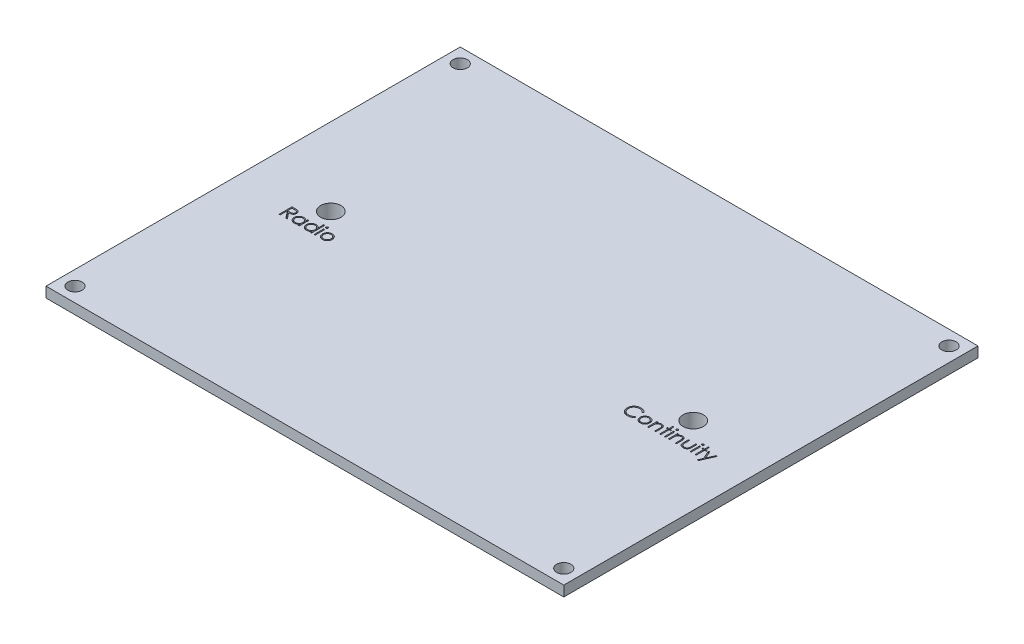
from build123d import *

# Parameters (mm, degrees)
IZIM1_W                     = 127
IZIM1_H                     = 101.6
Y_KSEKLIK_EKSTR_ZYON1_DEPTH = 2.54
IZIM3_W                     = 113.03
IZIM3_H                     = 87.63
Y_KSEKLIK_EKSTR_ZYON2_DEPTH = 1.27
IZIM4_R                     = 1.7526
KES_EKSTR_ZYON1_DEPTH       = 2.54
IZIM5_R                     = 1.7526
KES_EKSTR_ZYON2_DEPTH       = 2.54
IZIM7_R                     = 1.7526
KES_EKSTR_ZYON3_DEPTH       = 2.54
IZIM9_R                     = 1.7526
KES_EKSTR_ZYON4_DEPTH       = 2.54
IZIM10_R                    = 2.5
KES_EKSTR_ZYON5_DEPTH       = 3.81
IZIM11_R                    = 2.5
KES_EKSTR_ZYON6_DEPTH       = 3.81
IZIM12_W                    = 0.284935898
IZIM12_H                    = 2.320192308
KES_EKSTR_ZYON9_DEPTH       = 0.762
IZIM13_W                    = 0.284935898
IZIM13_H                    = 2.320192308
IZIM13_W_2                  = 0.284935897
KES_EKSTR_ZYON10_DEPTH      = 0.762


with BuildPart() as part:
    # Çizim1 → Yükseklik-Ekstrüzyon1 (new body)
    with BuildSketch(Plane(origin=(0, 0, 0), x_dir=(1, 0, 0), z_dir=(0, 1, 0))):
        Rectangle(IZIM1_W, IZIM1_H)
    extrude(amount=Y_KSEKLIK_EKSTR_ZYON1_DEPTH)

    # Çizim3 → Yükseklik-Ekstrüzyon2 (add)
    with BuildSketch(Plane.XZ):
        Rectangle(IZIM3_W, IZIM3_H)
    extrude(amount=Y_KSEKLIK_EKSTR_ZYON2_DEPTH)

    # Çizim4 → Kes-Ekstrüzyon1 (cut)
    with BuildSketch(Plane(origin=(0, 2.54, 0), x_dir=(1, 0, 0), z_dir=(0, 1, 0))):
        with Locations((-59.944, 47.244)):
            Circle(IZIM4_R)
    extrude(amount=-KES_EKSTR_ZYON1_DEPTH, mode=Mode.SUBTRACT)

    # Çizim5 → Kes-Ekstrüzyon2 (cut)
    with BuildSketch(Plane(origin=(0, 2.54, 0), x_dir=(1, 0, 0), z_dir=(0, 1, 0))):
        with Locations((59.944, 47.244)):
            Circle(IZIM5_R)
    extrude(amount=-KES_EKSTR_ZYON2_DEPTH, mode=Mode.SUBTRACT)

    # Çizim7 → Kes-Ekstrüzyon3 (cut)
    with BuildSketch(Plane(origin=(0, 2.54, 0), x_dir=(1, 0, 0), z_dir=(0, 1, 0))):
        with Locations((-59.944, -47.244)):
            Circle(IZIM7_R)
    extrude(amount=-KES_EKSTR_ZYON3_DEPTH, mode=Mode.SUBTRACT)

    # Çizim9 → Kes-Ekstrüzyon4 (cut)
    with BuildSketch(Plane(origin=(0, 2.54, 0), x_dir=(1, 0, 0), z_dir=(0, 1, 0))):
        with Locations((59.944, -47.244)):
            Circle(IZIM9_R)
    extrude(amount=-KES_EKSTR_ZYON4_DEPTH, mode=Mode.SUBTRACT)

    # Çizim10 → Kes-Ekstrüzyon5 (cut)
    with BuildSketch(Plane(origin=(0, 2.54, 0), x_dir=(1, 0, 0), z_dir=(0, 1, 0))):
        with Locations((-44.45, 0)):
            Circle(IZIM10_R)
    extrude(amount=-KES_EKSTR_ZYON5_DEPTH, mode=Mode.SUBTRACT)

    # Çizim11 → Kes-Ekstrüzyon6 (cut)
    with BuildSketch(Plane(origin=(0, 2.54, 0), x_dir=(1, 0, 0), z_dir=(0, 1, 0))):
        with Locations((44.45, 0)):
            Circle(IZIM11_R)
    extrude(amount=-KES_EKSTR_ZYON6_DEPTH, mode=Mode.SUBTRACT)

    # Çizim12 → Kes-Ekstrüzyon9 (cut)
    # profile 1 of 6: a face of its own
    with BuildSketch(Plane(origin=(0, 2.54, 0), x_dir=(1, 0, 0), z_dir=(0, 1, 0))):
        with BuildLine():
            Line((-50.185607271, -3.776425051), (-49.55022566, -3.776425051))
            add(Edge.make_bspline(
                [(-49.55022566, -3.776425051), (-49.507824779, -3.776566189), (-49.426410391, -3.776837191), (-49.309776067, -3.778348276), (-49.203797201, -3.782679299), (-49.108529204, -3.786406371), (-49.023973824, -3.793202632), (-48.949871782, -3.799698362), (-48.88656437, -3.808201612), (-48.848241348, -3.816098674), (-48.830889723, -3.819674249)],
                knots=[0, 0, 0, 0, 1.410062039, 2.707475311, 3.878576406, 4.937260626, 5.877586885, 6.699081471, 7.410979367, 8, 8, 8, 8], degree=3))
            add(Edge.make_bspline(
                [(-48.830889723, -3.819674249), (-48.807660857, -3.825413529), (-48.761698659, -3.836769655), (-48.695522528, -3.860772293), (-48.632463105, -3.888548667), (-48.572782336, -3.921172899), (-48.516779154, -3.958887163), (-48.463876115, -4.001040388), (-48.413833159, -4.047401925), (-48.368674109, -4.099140674), (-48.326093683, -4.153420937), (-48.290181143, -4.212116487), (-48.259223551, -4.273495159), (-48.234576011, -4.338181173), (-48.214729563, -4.405547209), (-48.20073576, -4.476203475), (-48.192343612, -4.549828074), (-48.191489214, -4.600045605), (-48.191055989, -4.625508584)],
                knots=[0, 0, 0, 0, 1.027469482, 2.033020251, 3.019912614, 3.986113645, 4.951240523, 5.91722682, 6.890402269, 7.87763091, 8.8651537, 9.85103654, 10.82876324, 11.815024772, 12.821070561, 13.842952187, 14.906261191, 16, 16, 16, 16], degree=3))
            add(Edge.make_bspline(
                [(-48.191055989, -4.625508584), (-48.19238858, -4.667813286), (-48.19498881, -4.750360717), (-48.219232297, -4.870158803), (-48.258943854, -4.981909109), (-48.313665695, -5.085470931), (-48.383351934, -5.178825588), (-48.467103709, -5.260822644), (-48.564967742, -5.32943885), (-48.656071479, -5.377021037), (-48.736547931, -5.407494604), (-48.802799579, -5.428936158), (-48.875068909, -5.44550237), (-48.952663491, -5.460343346), (-49.035906236, -5.471548098), (-49.124597628, -5.479754651), (-49.218800923, -5.484883681), (-49.28351565, -5.4856475), (-49.316807191, -5.486040435)],
                knots=[0, 0, 0, 0, 1.260483769, 2.459530307, 3.627416485, 4.787058657, 5.939039949, 7.08810263, 8.267026773, 9.491475466, 10.141966685, 10.831826277, 11.566392101, 12.351337768, 13.187381173, 14.07005841, 15.007169909, 16, 16, 16, 16], degree=3))
            Line((-49.316807191, -5.486040435), (-48.150350861, -6.951425051))
            Line((-48.150350861, -6.951425051), (-48.502704627, -6.951425051))
            Line((-48.502704627, -6.951425051), (-49.669160957, -5.486040435))
            Line((-49.669160957, -5.486040435), (-49.900671373, -5.486040435))
            Line((-49.900671373, -5.486040435), (-49.900671373, -6.951425051))
            Line((-49.900671373, -6.951425051), (-50.185607271, -6.951425051))
            Line((-50.185607271, -6.951425051), (-50.185607271, -3.776425051))
        make_face()
        with BuildLine():
            Line((-49.900671373, -4.102066076), (-49.900671373, -5.16039941))
            Line((-49.900671373, -5.16039941), (-49.319351261, -5.164851533))
            add(Edge.make_bspline(
                [(-49.319351261, -5.164851533), (-49.292209512, -5.164863541), (-49.239601071, -5.164886815), (-49.163491182, -5.161263889), (-49.09262508, -5.15714245), (-49.027273827, -5.150838401), (-48.967408226, -5.142713965), (-48.913058201, -5.132551258), (-48.864135033, -5.120711172), (-48.807077073, -5.102385412), (-48.743362505, -5.073351381), (-48.674118967, -5.031109821), (-48.61515256, -4.977979263), (-48.565334214, -4.917224771), (-48.525302515, -4.850426174), (-48.497079437, -4.778384182), (-48.479170222, -4.702917518), (-48.477057898, -4.651048806), (-48.475991886, -4.624872567)],
                knots=[0, 0, 0, 0, 1.146690395, 2.22261258, 3.21895312, 4.145990853, 4.996080663, 5.770904154, 6.481378293, 7.121626537, 8.300444488, 9.431385265, 10.535395872, 11.636531494, 12.74115979, 13.810798291, 14.895190096, 16, 16, 16, 16], degree=3))
            add(Edge.make_bspline(
                [(-48.475991886, -4.624872567), (-48.477082382, -4.599339603), (-48.479243346, -4.548742587), (-48.496886158, -4.474669011), (-48.526721525, -4.404758278), (-48.566928126, -4.339294781), (-48.615913074, -4.27987172), (-48.673351376, -4.229028946), (-48.737672517, -4.187074074), (-48.797789961, -4.160264029), (-48.851523854, -4.143826734), (-48.898177903, -4.132259606), (-48.950893315, -4.12296641), (-49.009926052, -4.115520526), (-49.075024103, -4.109120684), (-49.146516622, -4.104810141), (-49.223929273, -4.102257565), (-49.277583989, -4.102131391), (-49.305358873, -4.102066076)],
                knots=[0, 0, 0, 0, 1.101028733, 2.181837193, 3.264309656, 4.369019818, 5.486613113, 6.575447106, 7.666700264, 8.788928104, 9.402425223, 10.0903467, 10.862060571, 11.710948788, 12.657782767, 13.684531032, 14.801375019, 16, 16, 16, 16], degree=3))
            Line((-49.305358873, -4.102066076), (-49.900671373, -4.102066076))
        make_face(mode=Mode.SUBTRACT)
    # profile 2 of 6: a face of its own
    with BuildSketch(Plane(origin=(0, 2.54, 0), x_dir=(1, 0, 0), z_dir=(0, 1, 0))):
        with BuildLine():
            Line((-45.21958163, -4.631232743), (-45.21958163, -6.951425051))
            Line((-45.21958163, -6.951425051), (-45.504517527, -6.951425051))
            Line((-45.504517527, -6.951425051), (-45.504517527, -6.550097927))
            add(Edge.make_bspline(
                [(-45.504517527, -6.550097927), (-45.53664743, -6.586419559), (-45.59934934, -6.65730168), (-45.704070925, -6.749904794), (-45.815076344, -6.826447985), (-45.931826828, -6.888269694), (-46.054216949, -6.934708203), (-46.181975399, -6.967715647), (-46.315154295, -6.988937198), (-46.406097502, -6.991056303), (-46.452183793, -6.992130179)],
                knots=[0, 0, 0, 0, 1.074387032, 2.096679803, 3.090159297, 4.057316773, 5.018401886, 5.985159533, 6.978961417, 8, 8, 8, 8], degree=3))
            add(Edge.make_bspline(
                [(-46.452183793, -6.992130179), (-46.49315758, -6.991017684), (-46.573959702, -6.988823795), (-46.692821793, -6.971803705), (-46.807205476, -6.944470927), (-46.917218839, -6.906460834), (-47.022149999, -6.856041089), (-47.122897373, -6.795678671), (-47.218939029, -6.723795918), (-47.308811068, -6.641619635), (-47.391571525, -6.552361326), (-47.464198537, -6.457160722), (-47.524753117, -6.35642949), (-47.575389904, -6.251442986), (-47.614393731, -6.141393023), (-47.641584099, -6.026660163), (-47.658584361, -5.907380064), (-47.660777344, -5.826154925), (-47.661889322, -5.784968721)],
                knots=[0, 0, 0, 0, 1.033919861, 2.038935746, 3.024066025, 3.998881131, 4.97069526, 5.957263378, 6.95902576, 7.993208707, 9.027059324, 10.027763471, 11.009749337, 11.988697705, 12.965288445, 13.950418724, 14.960734635, 16, 16, 16, 16], degree=3))
            add(Edge.make_bspline(
                [(-47.661889322, -5.784968721), (-47.660752698, -5.744633789), (-47.658505654, -5.664893807), (-47.641765947, -5.547619559), (-47.613616389, -5.434663708), (-47.57411227, -5.32638991), (-47.52345564, -5.22266715), (-47.461835161, -5.12342207), (-47.389246383, -5.02838126), (-47.305560271, -4.939779504), (-47.214905158, -4.857936518), (-47.117923667, -4.786808313), (-47.017028262, -4.725379457), (-46.910653959, -4.676708089), (-46.800375228, -4.63732983), (-46.685210317, -4.610085638), (-46.565638385, -4.594031639), (-46.484457724, -4.591706846), (-46.443279546, -4.590527615)],
                knots=[0, 0, 0, 0, 1.020392517, 2.01726096, 2.990465484, 3.961182959, 4.928053699, 5.906110375, 6.912531644, 7.948652711, 8.985773172, 9.998621852, 10.987621588, 11.969261332, 12.953316658, 13.946091881, 14.958173133, 16, 16, 16, 16], degree=3))
            add(Edge.make_bspline(
                [(-46.443279546, -4.590527615), (-46.395926817, -4.591831861), (-46.30307035, -4.594389426), (-46.167245656, -4.615673471), (-46.038753879, -4.651631224), (-45.916603146, -4.700542097), (-45.801232095, -4.76553773), (-45.693732959, -4.847525266), (-45.592980699, -4.945987628), (-45.534578577, -5.021616531), (-45.504517527, -5.060544642)],
                knots=[0, 0, 0, 0, 1.038897134, 2.037228247, 3.008116434, 3.962042015, 4.918381754, 5.904844433, 6.921570401, 8, 8, 8, 8], degree=3))
            Line((-45.504517527, -5.060544642), (-45.504517527, -4.631232743))
            Line((-45.504517527, -4.631232743), (-45.21958163, -4.631232743))
        make_face()
        with BuildLine():
            add(Edge.make_bspline(
                [(-46.439463441, -4.875463512), (-46.481114304, -4.876945455), (-46.563326484, -4.879870574), (-46.6840164, -4.902706531), (-46.799507855, -4.940701841), (-46.909223222, -4.992664709), (-47.01142939, -5.058005063), (-47.102772934, -5.137036603), (-47.184000956, -5.227603038), (-47.25231631, -5.329295666), (-47.308006261, -5.438314363), (-47.347164926, -5.552273675), (-47.3729906, -5.66911819), (-47.375629044, -5.748368627), (-47.376953425, -5.788148809)],
                knots=[0, 0, 0, 0, 1.031046209, 2.035121221, 3.029706178, 4.034933723, 5.034054252, 6.02443088, 7.017295772, 8.038157696, 9.050218397, 10.03989886, 11.016116709, 12, 12, 12, 12], degree=3))
            add(Edge.make_bspline(
                [(-47.376953425, -5.788148809), (-47.3752617, -5.827691263), (-47.371884882, -5.906621179), (-47.34761818, -6.023624988), (-47.306905724, -6.137611154), (-47.251350424, -6.247612199), (-47.1817847, -6.349742061), (-47.101149994, -6.442034886), (-47.008666524, -6.521400442), (-46.906225143, -6.587837383), (-46.796816484, -6.641506242), (-46.681759989, -6.678849357), (-46.563218517, -6.702959201), (-46.482616757, -6.705775405), (-46.442007511, -6.707194281)],
                knots=[0, 0, 0, 0, 0.979072187, 1.954306742, 2.945804271, 3.96968567, 4.997920485, 5.998718438, 6.996577872, 8.005894225, 9.015743152, 10.005417472, 10.995077863, 12, 12, 12, 12], degree=3))
            add(Edge.make_bspline(
                [(-46.442007511, -6.707194281), (-46.400781041, -6.705688457), (-46.31878568, -6.702693522), (-46.19773771, -6.679759802), (-46.080267279, -6.641869535), (-45.967974579, -6.589346756), (-45.863366374, -6.524252583), (-45.769479014, -6.448046151), (-45.690089528, -6.359415405), (-45.622786232, -6.262009623), (-45.570012819, -6.155228026), (-45.531571679, -6.04153201), (-45.508844208, -5.920917617), (-45.505979696, -5.838491055), (-45.504517527, -5.796417038)],
                knots=[0, 0, 0, 0, 1.01762866, 2.023962475, 3.030623092, 4.058876274, 5.077231937, 6.066672613, 7.034107872, 8.005628644, 8.981990164, 9.965428785, 10.961468474, 12, 12, 12, 12], degree=3))
            add(Edge.make_bspline(
                [(-45.504517527, -5.796417038), (-45.505388073, -5.764360577), (-45.507101582, -5.701263319), (-45.52019217, -5.60861907), (-45.541015567, -5.519960619), (-45.570358164, -5.435194751), (-45.608903829, -5.35479013), (-45.655392874, -5.278169433), (-45.710642818, -5.205731163), (-45.773764264, -5.138472806), (-45.842856983, -5.077125943), (-45.915967745, -5.022366954), (-45.993962751, -4.977382853), (-46.075530349, -4.940152556), (-46.160812059, -4.910526042), (-46.250501836, -4.890761491), (-46.343646346, -4.877190343), (-46.407188124, -4.876045183), (-46.439463441, -4.875463512)],
                knots=[0, 0, 0, 0, 1.050140795, 2.067009409, 3.05949893, 4.030605086, 5.00011959, 5.97591094, 6.962425594, 7.979863591, 8.993523472, 9.986985069, 10.967611495, 11.937549037, 12.921786183, 13.919465291, 14.943216303, 16, 16, 16, 16], degree=3))
        make_face(mode=Mode.SUBTRACT)
    # profile 3 of 6: a face of its own
    with BuildSketch(Plane(origin=(0, 2.54, 0), x_dir=(1, 0, 0), z_dir=(0, 1, 0))):
        with BuildLine():
            Line((-42.207402143, -3.695014794), (-42.207402143, -6.951425051))
            Line((-42.207402143, -6.951425051), (-42.49233804, -6.951425051))
            Line((-42.49233804, -6.951425051), (-42.49233804, -6.550097927))
            add(Edge.make_bspline(
                [(-42.49233804, -6.550097927), (-42.524467943, -6.586419559), (-42.587169853, -6.65730168), (-42.691891438, -6.749904794), (-42.802896857, -6.826447985), (-42.919647341, -6.888269694), (-43.042037462, -6.934708203), (-43.169795912, -6.967715647), (-43.302974808, -6.988937198), (-43.393918015, -6.991056303), (-43.440004306, -6.992130179)],
                knots=[0, 0, 0, 0, 1.074387032, 2.096679803, 3.090159297, 4.057316773, 5.018401886, 5.985159533, 6.978961417, 8, 8, 8, 8], degree=3))
            add(Edge.make_bspline(
                [(-43.440004306, -6.992130179), (-43.480978093, -6.991017684), (-43.561780214, -6.988823795), (-43.680642306, -6.971803705), (-43.795025989, -6.944470927), (-43.905039352, -6.906460834), (-44.009970512, -6.856041089), (-44.110717885, -6.795678671), (-44.206759542, -6.723795918), (-44.296631581, -6.641619635), (-44.379392038, -6.552361326), (-44.45201905, -6.457160722), (-44.512573629, -6.35642949), (-44.563210417, -6.251442986), (-44.602214244, -6.141393023), (-44.629404612, -6.026660163), (-44.646404874, -5.907380064), (-44.648597856, -5.826154925), (-44.649709835, -5.784968721)],
                knots=[0, 0, 0, 0, 1.033919861, 2.038935746, 3.024066025, 3.998881131, 4.97069526, 5.957263378, 6.95902576, 7.993208707, 9.027059324, 10.027763471, 11.009749337, 11.988697705, 12.965288445, 13.950418724, 14.960734635, 16, 16, 16, 16], degree=3))
            add(Edge.make_bspline(
                [(-44.649709835, -5.784968721), (-44.648573211, -5.744633789), (-44.646326166, -5.664893807), (-44.62958646, -5.547619559), (-44.601436902, -5.434663708), (-44.561932783, -5.32638991), (-44.511276153, -5.22266715), (-44.449655674, -5.12342207), (-44.377066896, -5.02838126), (-44.293380784, -4.939779504), (-44.202725671, -4.857936518), (-44.10574418, -4.786808313), (-44.004848774, -4.725379457), (-43.898474472, -4.676708089), (-43.788195741, -4.63732983), (-43.67303083, -4.610085638), (-43.553458898, -4.594031639), (-43.472278237, -4.591706846), (-43.431100059, -4.590527615)],
                knots=[0, 0, 0, 0, 1.020392517, 2.01726096, 2.990465484, 3.961182959, 4.928053699, 5.906110375, 6.912531644, 7.948652711, 8.985773172, 9.998621852, 10.987621588, 11.969261332, 12.953316658, 13.946091881, 14.958173133, 16, 16, 16, 16], degree=3))
            add(Edge.make_bspline(
                [(-43.431100059, -4.590527615), (-43.383731955, -4.591949195), (-43.290753631, -4.594739598), (-43.154774258, -4.618058946), (-43.02615264, -4.657213842), (-42.904148287, -4.710818076), (-42.78948855, -4.780487329), (-42.681332954, -4.864626142), (-42.581562369, -4.965615767), (-42.52253293, -5.041463409), (-42.49233804, -5.080261189)],
                knots=[0, 0, 0, 0, 1.031072012, 2.023879775, 2.993683497, 3.952812103, 4.918022106, 5.908088563, 6.929940113, 8, 8, 8, 8], degree=3))
            Line((-42.49233804, -5.080261189), (-42.49233804, -3.695014794))
            Line((-42.49233804, -3.695014794), (-42.207402143, -3.695014794))
        make_face()
        with BuildLine():
            add(Edge.make_bspline(
                [(-43.427283954, -4.875463512), (-43.468934817, -4.876945455), (-43.551146997, -4.879870574), (-43.671836913, -4.902706531), (-43.787328368, -4.940701841), (-43.897043735, -4.992664709), (-43.999249903, -5.058005063), (-44.090593447, -5.137036603), (-44.171821469, -5.227603038), (-44.240136823, -5.329295666), (-44.295826774, -5.438314363), (-44.334985438, -5.552273675), (-44.360811113, -5.66911819), (-44.363449557, -5.748368627), (-44.364773938, -5.788148809)],
                knots=[0, 0, 0, 0, 1.031046209, 2.035121221, 3.029706178, 4.034933723, 5.034054252, 6.02443088, 7.017295772, 8.038157696, 9.050218397, 10.03989886, 11.016116709, 12, 12, 12, 12], degree=3))
            add(Edge.make_bspline(
                [(-44.364773938, -5.788148809), (-44.363082213, -5.827691263), (-44.359705395, -5.906621179), (-44.335438693, -6.023624988), (-44.294726237, -6.137611154), (-44.239170937, -6.247612199), (-44.169605213, -6.349742061), (-44.088970507, -6.442034886), (-43.996487037, -6.521400442), (-43.894045656, -6.587837383), (-43.784636997, -6.641506242), (-43.669580502, -6.678849357), (-43.55103903, -6.702959201), (-43.47043727, -6.705775405), (-43.429828024, -6.707194281)],
                knots=[0, 0, 0, 0, 0.979072187, 1.954306742, 2.945804271, 3.96968567, 4.997920485, 5.998718438, 6.996577872, 8.005894225, 9.015743152, 10.005417472, 10.995077863, 12, 12, 12, 12], degree=3))
            add(Edge.make_bspline(
                [(-43.429828024, -6.707194281), (-43.388601554, -6.705688457), (-43.306606193, -6.702693522), (-43.185558222, -6.679759802), (-43.068087792, -6.641869535), (-42.955795092, -6.589346756), (-42.851186887, -6.524252583), (-42.757299527, -6.448046151), (-42.677910041, -6.359415405), (-42.610606745, -6.262009623), (-42.557833332, -6.155228026), (-42.519392192, -6.04153201), (-42.49666472, -5.920917617), (-42.493800209, -5.838491055), (-42.49233804, -5.796417038)],
                knots=[0, 0, 0, 0, 1.01762866, 2.023962475, 3.030623092, 4.058876274, 5.077231937, 6.066672613, 7.034107872, 8.005628644, 8.981990164, 9.965428785, 10.961468474, 12, 12, 12, 12], degree=3))
            add(Edge.make_bspline(
                [(-42.49233804, -5.796417038), (-42.493208586, -5.764360577), (-42.494922094, -5.701263319), (-42.508012682, -5.60861907), (-42.52883608, -5.519960619), (-42.558178677, -5.435194751), (-42.596724342, -5.35479013), (-42.643213387, -5.278169433), (-42.698463331, -5.205731163), (-42.761584776, -5.138472806), (-42.830677496, -5.077125943), (-42.903788258, -5.022366954), (-42.981783264, -4.977382853), (-43.063350862, -4.940152556), (-43.148632572, -4.910526042), (-43.238322349, -4.890761491), (-43.331466858, -4.877190343), (-43.395008637, -4.876045183), (-43.427283954, -4.875463512)],
                knots=[0, 0, 0, 0, 1.050140795, 2.067009409, 3.05949893, 4.030605086, 5.00011959, 5.97591094, 6.962425594, 7.979863591, 8.993523472, 9.986985069, 10.967611495, 11.937549037, 12.921786183, 13.919465291, 14.943216303, 16, 16, 16, 16], degree=3))
        make_face(mode=Mode.SUBTRACT)
    # profile 4 of 6: a face of its own
    with BuildSketch(Plane(origin=(0, 2.54, 0), x_dir=(1, 0, 0), z_dir=(0, 1, 0))):
        with BuildLine():
            add(Edge.make_bspline(
                [(-41.455629306, -3.654309666), (-41.437947898, -3.655129861), (-41.403324306, -3.656735962), (-41.353256127, -3.670489587), (-41.307665838, -3.693802873), (-41.267227466, -3.72508087), (-41.23252754, -3.761865008), (-41.20823361, -3.804737457), (-41.192619508, -3.851054937), (-41.190733961, -3.883362911), (-41.189773938, -3.899812471)],
                knots=[0, 0, 0, 0, 1.055194115, 2.066272739, 3.074728998, 4.095836921, 5.109056067, 6.073838105, 7.019297344, 8, 8, 8, 8], degree=3))
            add(Edge.make_bspline(
                [(-41.189773938, -3.899812471), (-41.190755611, -3.91583502), (-41.192696264, -3.947509705), (-41.208221549, -3.993024212), (-41.232734579, -4.035300954), (-41.267205215, -4.07201367), (-41.307671734, -4.103274375), (-41.353254561, -4.126592246), (-41.403324718, -4.140344656), (-41.437948037, -4.141950924), (-41.455629306, -4.142771205)],
                knots=[0, 0, 0, 0, 0.96129708, 1.900370562, 2.859976407, 3.87933698, 4.906634145, 5.921202961, 6.938410037, 8, 8, 8, 8], degree=3))
            add(Edge.make_bspline(
                [(-41.455629306, -4.142771205), (-41.473108384, -4.141982244), (-41.507129126, -4.140446636), (-41.556447619, -4.126322405), (-41.601649177, -4.103266396), (-41.642166416, -4.072218357), (-41.67593952, -4.035075486), (-41.700521572, -3.993050012), (-41.716011002, -3.947503136), (-41.717956486, -3.915832814), (-41.718940604, -3.899812471)],
                knots=[0, 0, 0, 0, 1.054934014, 2.053291228, 3.073705704, 4.106921865, 5.123545215, 6.088680038, 7.033164197, 8, 8, 8, 8], degree=3))
            add(Edge.make_bspline(
                [(-41.718940604, -3.899812471), (-41.717978047, -3.8833652), (-41.716087524, -3.851061722), (-41.700509962, -3.804711228), (-41.676144279, -3.762092295), (-41.642144053, -3.724876306), (-41.601655129, -3.693810804), (-41.556446081, -3.670759414), (-41.507129533, -3.656633985), (-41.473108522, -3.655098542), (-41.455629306, -3.654309666)],
                knots=[0, 0, 0, 0, 0.98631895, 1.937192651, 2.907499808, 3.917963147, 4.944918757, 5.95915025, 6.951458133, 8, 8, 8, 8], degree=3))
        make_face()
    # profile 5 of 6: a face of its own
    with BuildSketch(Plane(origin=(0, 2.54, 0), x_dir=(1, 0, 0), z_dir=(0, 1, 0))):
        with Locations((-41.454357271, -5.791328897)):
            Rectangle(IZIM12_W, IZIM12_H)
    # profile 6 of 6: a face of its own
    with BuildSketch(Plane(origin=(0, 2.54, 0), x_dir=(1, 0, 0), z_dir=(0, 1, 0))):
        with BuildLine():
            add(Edge.make_bspline(
                [(-39.499239082, -4.590527615), (-39.455704141, -4.591454616), (-39.370342763, -4.593272239), (-39.245331323, -4.612698672), (-39.126001093, -4.64240521), (-39.011895047, -4.683472984), (-38.904474551, -4.738520182), (-38.802174922, -4.804205753), (-38.705276635, -4.88202282), (-38.647198602, -4.942219068), (-38.617718649, -4.972774209)],
                knots=[0, 0, 0, 0, 1.054011418, 2.066658804, 3.057071809, 4.030435133, 4.997543892, 5.974964718, 6.972108034, 8, 8, 8, 8], degree=3))
            add(Edge.make_bspline(
                [(-38.617718649, -4.972774209), (-38.592335019, -5.001996896), (-38.542059003, -5.059876731), (-38.477592244, -5.153725752), (-38.422055543, -5.250917128), (-38.377548428, -5.352741489), (-38.342455585, -5.458309941), (-38.317540275, -5.567985337), (-38.302720341, -5.681525466), (-38.300721935, -5.75863609), (-38.299709835, -5.797689073)],
                knots=[0, 0, 0, 0, 1.025258237, 2.030674902, 3.01204498, 3.988269485, 4.97094183, 5.956517959, 6.965070386, 8, 8, 8, 8], degree=3))
            add(Edge.make_bspline(
                [(-38.299709835, -5.797689073), (-38.300600048, -5.836968411), (-38.302359151, -5.914586215), (-38.318999431, -6.028903783), (-38.344881202, -6.139751943), (-38.381921512, -6.246666615), (-38.429417797, -6.349974609), (-38.487375778, -6.4492247), (-38.556202174, -6.544612706), (-38.634220085, -6.63532866), (-38.720445716, -6.718936583), (-38.813986793, -6.791805799), (-38.913005095, -6.854236753), (-39.01881728, -6.904525502), (-39.130457071, -6.944176444), (-39.248165269, -6.972025745), (-39.371759011, -6.988863844), (-39.456147991, -6.991026085), (-39.499239082, -6.992130179)],
                knots=[0, 0, 0, 0, 0.998656419, 1.973391657, 2.932242238, 3.890759089, 4.846373663, 5.82037756, 6.809684879, 7.83454468, 8.860553229, 9.859544525, 10.845671541, 11.83227036, 12.833544569, 13.85385346, 14.904124723, 16, 16, 16, 16], degree=3))
            add(Edge.make_bspline(
                [(-39.499239082, -6.992130179), (-39.542541292, -6.991022379), (-39.627350857, -6.988852698), (-39.751380855, -6.972091163), (-39.869300009, -6.944189279), (-39.981085952, -6.904395196), (-40.087353064, -6.854235146), (-40.1869451, -6.791994542), (-40.280562166, -6.718914973), (-40.366806038, -6.635334515), (-40.444819058, -6.544611198), (-40.513646716, -6.449225091), (-40.571604369, -6.349974507), (-40.61910074, -6.246666642), (-40.656141027, -6.139751936), (-40.682022804, -6.028903784), (-40.698663083, -5.914586214), (-40.700422186, -5.836968411), (-40.701312399, -5.797689073)],
                knots=[0, 0, 0, 0, 1.099876186, 2.154163076, 3.173186993, 4.173200201, 5.163417411, 6.152872554, 7.150605724, 8.17532212, 9.198891216, 10.186952605, 11.159729845, 12.11414092, 13.071450619, 14.029093627, 15.002601286, 16, 16, 16, 16], degree=3))
            add(Edge.make_bspline(
                [(-40.701312399, -5.797689073), (-40.700293396, -5.758848349), (-40.698275945, -5.681950391), (-40.683470912, -5.568623701), (-40.658652793, -5.459133926), (-40.623517883, -5.353972959), (-40.578600532, -5.252594813), (-40.52384422, -5.155163288), (-40.458719861, -5.06173864), (-40.408643805, -5.003933611), (-40.383303585, -4.974682262)],
                knots=[0, 0, 0, 0, 1.031353054, 2.041901799, 3.029428768, 4.008703097, 4.981709435, 5.96992636, 6.972712378, 8, 8, 8, 8], degree=3))
            add(Edge.make_bspline(
                [(-40.383303585, -4.974682262), (-40.353868077, -4.943862139), (-40.295977972, -4.883248943), (-40.198597341, -4.805658725), (-40.096549374, -4.738606286), (-39.987941763, -4.684652862), (-39.873929456, -4.642163635), (-39.753987715, -4.612622061), (-39.628552068, -4.593342232), (-39.542772984, -4.591475171), (-39.499239082, -4.590527615)],
                knots=[0, 0, 0, 0, 1.027980169, 2.021703884, 2.998553061, 3.971491411, 4.943284454, 5.930300938, 6.949603206, 8, 8, 8, 8], degree=3))
        make_face()
        with BuildLine():
            add(Edge.make_bspline(
                [(-39.500511117, -4.875463512), (-39.531297379, -4.876338535), (-39.59207516, -4.878065991), (-39.681537212, -4.891204962), (-39.767661494, -4.912021626), (-39.850611403, -4.941598163), (-39.930107209, -4.979787878), (-40.006225024, -5.026694748), (-40.079188737, -5.081697501), (-40.147571038, -5.144710068), (-40.210329278, -5.213543156), (-40.265191443, -5.286884167), (-40.31184136, -5.363543495), (-40.350703505, -5.443600858), (-40.379647882, -5.527867548), (-40.400669124, -5.615389263), (-40.4137957, -5.70634432), (-40.415506914, -5.768176101), (-40.416376502, -5.799597126)],
                knots=[0, 0, 0, 0, 1.021534396, 2.016698045, 2.994645724, 3.958388632, 4.93408049, 5.916473867, 6.921342795, 7.962252576, 8.998418191, 10.008913653, 10.997312074, 11.973003931, 12.956656626, 13.948281152, 14.957379055, 16, 16, 16, 16], degree=3))
            add(Edge.make_bspline(
                [(-40.416376502, -5.799597126), (-40.414918883, -5.840193608), (-40.412025783, -5.920770033), (-40.388498818, -6.039434408), (-40.349141264, -6.153355088), (-40.295994232, -6.261864239), (-40.229404305, -6.362259805), (-40.15094818, -6.451768937), (-40.061467881, -6.529044638), (-39.962030056, -6.593162262), (-39.854665781, -6.644107183), (-39.741040404, -6.68021054), (-39.622530632, -6.703679861), (-39.541540254, -6.706012555), (-39.500511117, -6.707194281)],
                knots=[0, 0, 0, 0, 1.016792936, 2.018143844, 3.017858371, 4.030088057, 5.03801393, 6.028138512, 7.003788237, 7.991172063, 8.984598303, 9.972568034, 10.972917682, 12, 12, 12, 12], degree=3))
            add(Edge.make_bspline(
                [(-39.500511117, -6.707194281), (-39.459484339, -6.70600567), (-39.37849862, -6.703659384), (-39.26015351, -6.680328741), (-39.146838693, -6.643948991), (-39.039585934, -6.593219558), (-38.940193372, -6.528801153), (-38.850069526, -6.452205297), (-38.772283286, -6.362022732), (-38.70575923, -6.261731259), (-38.651741828, -6.153523311), (-38.612568495, -6.039413383), (-38.588984971, -5.920775388), (-38.586099505, -5.840195402), (-38.584645732, -5.799597126)],
                knots=[0, 0, 0, 0, 1.02726834, 2.027799167, 3.010890988, 4.004497153, 4.992059811, 5.971914811, 6.958719428, 7.966827853, 8.981595046, 9.981490638, 10.983022906, 12, 12, 12, 12], degree=3))
            add(Edge.make_bspline(
                [(-38.584645732, -5.799597126), (-38.58551502, -5.768175913), (-38.587225646, -5.706343763), (-38.600356506, -5.615391394), (-38.621361889, -5.527859731), (-38.650364713, -5.4436297), (-38.689057997, -5.363336214), (-38.736607517, -5.287109247), (-38.791245661, -5.213289094), (-38.854761192, -5.144932577), (-38.923072113, -5.081672937), (-38.996065398, -5.02667342), (-39.072070343, -4.979994029), (-39.1513352, -4.941271511), (-39.234295744, -4.91229071), (-39.320299354, -4.891084765), (-39.409379703, -4.878121516), (-39.469939692, -4.87635518), (-39.500511117, -4.875463512)],
                knots=[0, 0, 0, 0, 1.042956736, 2.052379634, 3.044323526, 4.02829302, 5.004299113, 5.996692471, 7.007513377, 8.048758398, 9.090003419, 10.095195979, 11.07790575, 12.047570684, 13.018257071, 13.989683339, 14.985167495, 16, 16, 16, 16], degree=3))
        make_face(mode=Mode.SUBTRACT)
    extrude(amount=-KES_EKSTR_ZYON9_DEPTH, mode=Mode.SUBTRACT)

    # Çizim13 → Kes-Ekstrüzyon10 (cut)
    # profile 1 of 12: a face of its own
    with BuildSketch(Plane(origin=(0, 2.54, 0), x_dir=(1, 0, 0), z_dir=(0, 1, 0))):
        with BuildLine():
            Line((36.723364142, -4.359017198), (36.474045232, -4.549822487))
            add(Edge.make_bspline(
                [(36.474045232, -4.549822487), (36.45625989, -4.528626214), (36.420928992, -4.48651944), (36.364088144, -4.427392282), (36.304850225, -4.371997367), (36.243237879, -4.320070804), (36.178142107, -4.273428452), (36.111139811, -4.229639666), (36.041110155, -4.190389647), (35.944271082, -4.142798224), (35.817590534, -4.09313564), (35.658119501, -4.051494852), (35.491648719, -4.024987071), (35.378076611, -4.022116108), (35.320309254, -4.02065582)],
                knots=[0, 0, 0, 0, 0.757959112, 1.505699292, 2.245454638, 2.979532153, 3.711538275, 4.438200793, 5.171680507, 5.909471876, 7.393775596, 8.890124382, 10.418191784, 12, 12, 12, 12], degree=3))
            add(Edge.make_bspline(
                [(35.320309254, -4.02065582), (35.28848369, -4.021022272), (35.225127932, -4.021751774), (35.13110396, -4.031375766), (35.038835692, -4.044902364), (34.948383148, -4.064973193), (34.859861464, -4.090348354), (34.772691928, -4.12066998), (34.688136598, -4.158184727), (34.605025768, -4.199648649), (34.525397483, -4.246482117), (34.45005469, -4.297566372), (34.379272176, -4.352329766), (34.312993949, -4.410977556), (34.251152253, -4.47324562), (34.194195193, -4.539797558), (34.142319856, -4.610420601), (34.094497984, -4.684183478), (34.05166929, -4.760871332), (34.015810042, -4.840768003), (33.984055396, -4.922505297), (33.958928225, -5.007006707), (33.939039557, -5.093677644), (33.925316605, -5.182750716), (33.915802063, -5.27403984), (33.915076188, -5.335915431), (33.914710296, -5.367105139)],
                knots=[0, 0, 0, 0, 1.054917814, 2.100044995, 3.131103042, 4.146048494, 5.169673617, 6.183595914, 7.203665975, 8.234915748, 9.262203917, 10.264457458, 11.251630812, 12.227803204, 13.197192746, 14.159520551, 15.12972552, 16.100847026, 17.073214652, 18.039054194, 19.002613845, 19.979014051, 20.95965708, 21.949030935, 22.966165397, 24, 24, 24, 24], degree=3))
            add(Edge.make_bspline(
                [(33.914710296, -5.367105139), (33.915854946, -5.414032836), (33.918102315, -5.506169145), (33.938103303, -5.641125342), (33.968497208, -5.770411953), (34.01404991, -5.89322081), (34.070219334, -6.011066249), (34.141194746, -6.121954352), (34.22339689, -6.227560807), (34.317988685, -6.325389767), (34.421771104, -6.414755789), (34.533120995, -6.493450959), (34.651761028, -6.559050888), (34.776381257, -6.613639068), (34.90794066, -6.655600529), (35.046202659, -6.685140841), (35.190866541, -6.704410533), (35.289717353, -6.706255379), (35.340025801, -6.707194281)],
                knots=[0, 0, 0, 0, 1.029171465, 2.020641659, 2.987623507, 3.938342917, 4.889210282, 5.84687017, 6.821220943, 7.821438502, 8.827599549, 9.822697543, 10.807740252, 11.797342354, 12.80366471, 13.83203677, 14.896651826, 16, 16, 16, 16], degree=3))
            add(Edge.make_bspline(
                [(35.340025801, -6.707194281), (35.395454669, -6.705662317), (35.50455194, -6.702647044), (35.664542936, -6.677102583), (35.817701094, -6.635684329), (35.964034655, -6.577719785), (36.103131084, -6.502367702), (36.235208054, -6.411020342), (36.360377051, -6.302808783), (36.435643857, -6.220183374), (36.474045232, -6.178027615)],
                knots=[0, 0, 0, 0, 1.028121516, 2.023589091, 2.998037872, 3.967518031, 4.937445131, 5.927275754, 6.942489185, 8, 8, 8, 8], degree=3))
            Line((36.474045232, -6.178027615), (36.723364142, -6.36692485))
            add(Edge.make_bspline(
                [(36.723364142, -6.36692485), (36.703299857, -6.392813303), (36.663267393, -6.444466205), (36.598444763, -6.517284113), (36.5301575, -6.585777059), (36.457898392, -6.64939283), (36.382498681, -6.709404381), (36.302604512, -6.764106756), (36.219266175, -6.814263487), (36.132766041, -6.86018934), (36.043196014, -6.9009357), (35.950663419, -6.935818761), (35.855567111, -6.965867768), (35.757902743, -6.990589167), (35.657467735, -7.009885079), (35.554624519, -7.022784356), (35.449151132, -7.031621664), (35.377993557, -7.03242713), (35.341933854, -7.032835307)],
                knots=[0, 0, 0, 0, 0.986787822, 1.968848986, 2.935600012, 3.899624008, 4.868462664, 5.837806735, 6.815139263, 7.798259679, 8.787526145, 9.778297419, 10.776456485, 11.791383307, 12.812564526, 13.85620153, 14.913611965, 16, 16, 16, 16], degree=3))
            add(Edge.make_bspline(
                [(35.341933854, -7.032835307), (35.30778567, -7.032597642), (35.240261865, -7.03212769), (35.140567998, -7.024514795), (35.043513164, -7.014128248), (34.949374753, -6.998488986), (34.857639047, -6.980033764), (34.76913766, -6.955294838), (34.682999719, -6.92758238), (34.599571296, -6.895011428), (34.518781425, -6.858257462), (34.440890682, -6.816717976), (34.36593489, -6.770742285), (34.293177115, -6.721343811), (34.223692164, -6.66693583), (34.156877895, -6.608273955), (34.092359648, -6.545555902), (34.052442927, -6.500330428), (34.032373557, -6.477591918)],
                knots=[0, 0, 0, 0, 1.114604814, 2.203992996, 3.262667896, 4.300477797, 5.318619304, 6.316056647, 7.298880507, 8.271930387, 9.238335007, 10.195173496, 11.151986948, 12.108099108, 13.064862484, 14.031167946, 15.010108607, 16, 16, 16, 16], degree=3))
            add(Edge.make_bspline(
                [(34.032373557, -6.477591918), (34.000228366, -6.438093839), (33.936326069, -6.359574538), (33.854569199, -6.232315112), (33.784585346, -6.099447522), (33.728001475, -5.96027373), (33.68376671, -5.815106028), (33.65312234, -5.66387124), (33.633209099, -5.506710607), (33.630931908, -5.399815806), (33.629774398, -5.345480539)],
                knots=[0, 0, 0, 0, 0.994628077, 1.977248131, 2.950237994, 3.925870899, 4.908910175, 5.911660606, 6.938484602, 8, 8, 8, 8], degree=3))
            add(Edge.make_bspline(
                [(33.629774398, -5.345480539), (33.631185181, -5.288370949), (33.633960808, -5.176011396), (33.657542708, -5.011116453), (33.695478331, -4.853136256), (33.749359794, -4.702365716), (33.817672505, -4.558011819), (33.902060934, -4.421177297), (34.001544698, -4.290987058), (34.115343563, -4.169416533), (34.240136789, -4.058255835), (34.373775999, -3.960460207), (34.515999622, -3.879073603), (34.665240816, -3.81104137), (34.822617113, -3.758749607), (34.98779274, -3.722143502), (35.160457327, -3.69935869), (35.278261099, -3.696478322), (35.338117748, -3.695014794)],
                knots=[0, 0, 0, 0, 1.032925535, 2.032216505, 3.007276963, 3.968222605, 4.92396291, 5.891752235, 6.871517503, 7.883894988, 8.900124299, 9.891468569, 10.874487609, 11.85992873, 12.854644235, 13.869047385, 14.917252991, 16, 16, 16, 16], degree=3))
            add(Edge.make_bspline(
                [(35.338117748, -3.695014794), (35.374598019, -3.695452163), (35.446807041, -3.696317889), (35.553625519, -3.704759889), (35.657622487, -3.718832946), (35.758869592, -3.737988238), (35.857859394, -3.761762023), (35.953835327, -3.79273215), (36.047360564, -3.828143861), (36.137845259, -3.868927612), (36.224855273, -3.914708156), (36.308363504, -3.964978043), (36.387706626, -4.019674953), (36.463442939, -4.07833369), (36.534305502, -4.14219524), (36.602306271, -4.20950306), (36.665135964, -4.282195886), (36.703919219, -4.333363219), (36.723364142, -4.359017198)],
                knots=[0, 0, 0, 0, 1.096760587, 2.17092713, 3.219439832, 4.250915756, 5.268269357, 6.278326846, 7.281116186, 8.274029601, 9.260640565, 10.235837813, 11.203064059, 12.156899882, 13.114053108, 14.069676657, 15.032185724, 16, 16, 16, 16], degree=3))
        make_face()
    # profile 2 of 12: a face of its own
    with BuildSketch(Plane(origin=(0, 2.54, 0), x_dir=(1, 0, 0), z_dir=(0, 1, 0))):
        with BuildLine():
            add(Edge.make_bspline(
                [(38.413898998, -4.590527615), (38.457433938, -4.591454616), (38.542795317, -4.593272239), (38.667806756, -4.612698672), (38.787136987, -4.64240521), (38.901243032, -4.683472984), (39.008663529, -4.738520182), (39.110963157, -4.804205753), (39.207861444, -4.88202282), (39.265939478, -4.942219068), (39.29541943, -4.972774209)],
                knots=[0, 0, 0, 0, 1.054011418, 2.066658804, 3.057071809, 4.030435133, 4.997543892, 5.974964718, 6.972108034, 8, 8, 8, 8], degree=3))
            add(Edge.make_bspline(
                [(39.29541943, -4.972774209), (39.32080306, -5.001996896), (39.371079077, -5.059876731), (39.435545836, -5.153725752), (39.491082537, -5.250917128), (39.535589651, -5.352741489), (39.570682494, -5.458309941), (39.595597804, -5.567985337), (39.610417738, -5.681525466), (39.612416144, -5.75863609), (39.613428245, -5.797689073)],
                knots=[0, 0, 0, 0, 1.025258237, 2.030674902, 3.01204498, 3.988269485, 4.97094183, 5.956517959, 6.965070386, 8, 8, 8, 8], degree=3))
            add(Edge.make_bspline(
                [(39.613428245, -5.797689073), (39.612538031, -5.836968411), (39.610778929, -5.914586215), (39.594138648, -6.028903783), (39.568256877, -6.139751943), (39.531216567, -6.246666615), (39.483720282, -6.349974609), (39.425762301, -6.4492247), (39.356935906, -6.544612706), (39.278917994, -6.63532866), (39.192692364, -6.718936583), (39.099151287, -6.791805799), (39.000132985, -6.854236753), (38.8943208, -6.904525502), (38.782681008, -6.944176444), (38.664972811, -6.972025745), (38.541379068, -6.988863844), (38.456990089, -6.991026085), (38.413898998, -6.992130179)],
                knots=[0, 0, 0, 0, 0.998656419, 1.973391657, 2.932242238, 3.890759089, 4.846373663, 5.82037756, 6.809684879, 7.83454468, 8.860553229, 9.859544525, 10.845671541, 11.83227036, 12.833544569, 13.85385346, 14.904124723, 16, 16, 16, 16], degree=3))
            add(Edge.make_bspline(
                [(38.413898998, -6.992130179), (38.370596788, -6.991022379), (38.285787222, -6.988852698), (38.161757224, -6.972091163), (38.04383807, -6.944189279), (37.932052127, -6.904395196), (37.825785016, -6.854235146), (37.726192979, -6.791994542), (37.632575913, -6.718914973), (37.546332042, -6.635334515), (37.468319021, -6.544611198), (37.399491364, -6.449225091), (37.341533711, -6.349974507), (37.29403734, -6.246666642), (37.256997052, -6.139751936), (37.231115276, -6.028903784), (37.214474997, -5.914586214), (37.212715894, -5.836968411), (37.21182568, -5.797689073)],
                knots=[0, 0, 0, 0, 1.099876186, 2.154163076, 3.173186993, 4.173200201, 5.163417411, 6.152872554, 7.150605724, 8.17532212, 9.198891216, 10.186952605, 11.159729845, 12.11414092, 13.071450619, 14.029093627, 15.002601286, 16, 16, 16, 16], degree=3))
            add(Edge.make_bspline(
                [(37.21182568, -5.797689073), (37.212844683, -5.758848349), (37.214862134, -5.681950391), (37.229667167, -5.568623701), (37.254485286, -5.459133926), (37.289620196, -5.353972959), (37.334537548, -5.252594813), (37.389293859, -5.155163288), (37.454418219, -5.06173864), (37.504494275, -5.003933611), (37.529834495, -4.974682262)],
                knots=[0, 0, 0, 0, 1.031353054, 2.041901799, 3.029428768, 4.008703097, 4.981709435, 5.96992636, 6.972712378, 8, 8, 8, 8], degree=3))
            add(Edge.make_bspline(
                [(37.529834495, -4.974682262), (37.559270002, -4.943862139), (37.617160107, -4.883248943), (37.714540739, -4.805658725), (37.816588705, -4.738606286), (37.925196317, -4.684652862), (38.039208624, -4.642163635), (38.159150365, -4.612622061), (38.284586011, -4.593342232), (38.370365096, -4.591475171), (38.413898998, -4.590527615)],
                knots=[0, 0, 0, 0, 1.027980169, 2.021703884, 2.998553061, 3.971491411, 4.943284454, 5.930300938, 6.949603206, 8, 8, 8, 8], degree=3))
        make_face()
        with BuildLine():
            add(Edge.make_bspline(
                [(38.412626963, -4.875463512), (38.381840701, -4.876338535), (38.32106292, -4.878065991), (38.231600868, -4.891204962), (38.145476585, -4.912021626), (38.062526677, -4.941598163), (37.98303087, -4.979787878), (37.906913055, -5.026694748), (37.833949342, -5.081697501), (37.765567042, -5.144710068), (37.702808801, -5.213543156), (37.647946637, -5.286884167), (37.601296719, -5.363543495), (37.562434575, -5.443600858), (37.533490197, -5.527867548), (37.512468955, -5.615389263), (37.49934238, -5.70634432), (37.497631165, -5.768176101), (37.496761578, -5.799597126)],
                knots=[0, 0, 0, 0, 1.021534396, 2.016698045, 2.994645724, 3.958388632, 4.93408049, 5.916473867, 6.921342795, 7.962252576, 8.998418191, 10.008913653, 10.997312074, 11.973003931, 12.956656626, 13.948281152, 14.957379055, 16, 16, 16, 16], degree=3))
            add(Edge.make_bspline(
                [(37.496761578, -5.799597126), (37.498219196, -5.840193608), (37.501112297, -5.920770033), (37.524639261, -6.039434408), (37.563996815, -6.153355088), (37.617143847, -6.261864239), (37.683733774, -6.362259805), (37.762189899, -6.451768937), (37.851670199, -6.529044638), (37.951108024, -6.593162262), (38.058472298, -6.644107183), (38.172097675, -6.68021054), (38.290607448, -6.703679861), (38.371597825, -6.706012555), (38.412626963, -6.707194281)],
                knots=[0, 0, 0, 0, 1.016792936, 2.018143844, 3.017858371, 4.030088057, 5.03801393, 6.028138512, 7.003788237, 7.991172063, 8.984598303, 9.972568034, 10.972917682, 12, 12, 12, 12], degree=3))
            add(Edge.make_bspline(
                [(38.412626963, -6.707194281), (38.45365374, -6.70600567), (38.534639459, -6.703659384), (38.65298457, -6.680328741), (38.766299387, -6.643948991), (38.873552146, -6.593219558), (38.972944707, -6.528801153), (39.063068553, -6.452205297), (39.140854793, -6.362022732), (39.207378849, -6.261731259), (39.261396251, -6.153523311), (39.300569584, -6.039413383), (39.324153109, -5.920775388), (39.327038575, -5.840195402), (39.328492347, -5.799597126)],
                knots=[0, 0, 0, 0, 1.02726834, 2.027799167, 3.010890988, 4.004497153, 4.992059811, 5.971914811, 6.958719428, 7.966827853, 8.981595046, 9.981490638, 10.983022906, 12, 12, 12, 12], degree=3))
            add(Edge.make_bspline(
                [(39.328492347, -5.799597126), (39.327623059, -5.768175913), (39.325912434, -5.706343763), (39.312781573, -5.615391394), (39.291776191, -5.527859731), (39.262773366, -5.4436297), (39.224080082, -5.363336214), (39.176530563, -5.287109247), (39.121892419, -5.213289094), (39.058376887, -5.144932577), (38.990065966, -5.081672937), (38.917072681, -5.02667342), (38.841067737, -4.979994029), (38.761802879, -4.941271511), (38.678842336, -4.91229071), (38.592838726, -4.891084765), (38.503758377, -4.878121516), (38.443198388, -4.87635518), (38.412626963, -4.875463512)],
                knots=[0, 0, 0, 0, 1.042956736, 2.052379634, 3.044323526, 4.02829302, 5.004299113, 5.996692471, 7.007513377, 8.048758398, 9.090003419, 10.095195979, 11.07790575, 12.047570684, 13.018257071, 13.989683339, 14.985167495, 16, 16, 16, 16], degree=3))
        make_face(mode=Mode.SUBTRACT)
    # profile 3 of 12: a face of its own
    with BuildSketch(Plane(origin=(0, 2.54, 0), x_dir=(1, 0, 0), z_dir=(0, 1, 0))):
        with BuildLine():
            Line((40.183300039, -4.631232743), (40.468235937, -4.631232743))
            Line((40.468235937, -4.631232743), (40.468235937, -5.049732342))
            add(Edge.make_bspline(
                [(40.468235937, -5.049732342), (40.498659363, -5.011775015), (40.557697083, -4.938117498), (40.656017157, -4.841306691), (40.759924838, -4.761527808), (40.868783798, -4.697933652), (40.982741814, -4.649994213), (41.101104245, -4.615372261), (41.224579728, -4.594612452), (41.308548896, -4.591899886), (41.351028405, -4.590527615)],
                knots=[0, 0, 0, 0, 1.12780773, 2.188550248, 3.19190651, 4.159438251, 5.104880172, 6.052711206, 7.014878035, 8, 8, 8, 8], degree=3))
            add(Edge.make_bspline(
                [(41.351028405, -4.590527615), (41.393964051, -4.592110756), (41.477999469, -4.595209346), (41.600353139, -4.619717345), (41.714629003, -4.661577683), (41.8204196, -4.718920061), (41.915785001, -4.790227362), (41.99953683, -4.873301493), (42.068809205, -4.968856368), (42.115252527, -5.057505232), (42.145846507, -5.136144352), (42.16510727, -5.203496761), (42.181463947, -5.278533941), (42.195644175, -5.36102914), (42.205239127, -5.451560355), (42.212806777, -5.549756476), (42.218230307, -5.655585694), (42.218445487, -5.728779992), (42.21855645, -5.766524209)],
                knots=[0, 0, 0, 0, 1.235846778, 2.418850247, 3.575807741, 4.728682307, 5.871620074, 6.994088408, 8.11269785, 9.256955736, 9.865816715, 10.540099792, 11.271859618, 12.076849838, 12.949306005, 13.892391288, 14.913166135, 16, 16, 16, 16], degree=3))
            Line((42.21855645, -5.766524209), (42.21855645, -6.951425051))
            Line((42.21855645, -6.951425051), (41.933620552, -6.951425051))
            Line((41.933620552, -6.951425051), (41.933620552, -5.860018801))
            add(Edge.make_bspline(
                [(41.933620552, -5.860018801), (41.933445285, -5.828429869), (41.933110029, -5.768005617), (41.93205262, -5.681492289), (41.929503724, -5.603036607), (41.925922041, -5.532826138), (41.920679634, -5.470928301), (41.915216247, -5.417217028), (41.908535161, -5.371760515), (41.902581661, -5.344396476), (41.899911618, -5.332124169)],
                knots=[0, 0, 0, 0, 1.430800155, 2.736877192, 3.918605307, 4.986035426, 5.920637409, 6.731861385, 7.431261377, 8, 8, 8, 8], degree=3))
            add(Edge.make_bspline(
                [(41.899911618, -5.332124169), (41.890272743, -5.296100452), (41.871720891, -5.22676594), (41.825879349, -5.132718492), (41.767990771, -5.052710136), (41.697326293, -4.987235538), (41.614568489, -4.936280565), (41.519947009, -4.90092562), (41.414374957, -4.878812862), (41.340121338, -4.876611106), (41.30141903, -4.875463512)],
                knots=[0, 0, 0, 0, 1.084156227, 2.086665306, 3.027808233, 3.945421172, 4.874247719, 5.839848303, 6.874090471, 8, 8, 8, 8], degree=3))
            add(Edge.make_bspline(
                [(41.30141903, -4.875463512), (41.278497631, -4.875895316), (41.233136775, -4.876749846), (41.165872158, -4.885323523), (41.100626658, -4.899346551), (41.036745468, -4.918277386), (40.975506256, -4.944278159), (40.914941506, -4.973786945), (40.857331798, -5.010569966), (40.801448717, -5.051564315), (40.749457812, -5.09699331), (40.701081391, -5.14493083), (40.657957616, -5.195980842), (40.618888175, -5.249320795), (40.585162178, -5.305683248), (40.555722591, -5.36452444), (40.530743783, -5.425921818), (40.518331626, -5.468534909), (40.512121153, -5.489856541)],
                knots=[0, 0, 0, 0, 1.023777757, 2.026029729, 3.023749952, 4.003683103, 4.997618607, 5.993177895, 7.010360494, 8.046726602, 9.087585522, 10.09234134, 11.086953743, 12.070360549, 13.043493632, 14.017870808, 15.008233677, 16, 16, 16, 16], degree=3))
            add(Edge.make_bspline(
                [(40.512121153, -5.489856541), (40.508547329, -5.505509475), (40.500767301, -5.539585094), (40.492364274, -5.595505389), (40.484737402, -5.660193723), (40.478353875, -5.733574611), (40.474448247, -5.815904969), (40.470189759, -5.906833193), (40.468639396, -6.006721858), (40.468374189, -6.076264965), (40.468235937, -6.112517799)],
                knots=[0, 0, 0, 0, 0.615963638, 1.340920617, 2.168419149, 3.115676021, 4.16674242, 5.331190069, 6.6087489, 8, 8, 8, 8], degree=3))
            Line((40.468235937, -6.112517799), (40.468235937, -6.951425051))
            Line((40.468235937, -6.951425051), (40.183300039, -6.951425051))
            Line((40.183300039, -6.951425051), (40.183300039, -4.631232743))
        make_face()
    # profile 4 of 12: a face of its own
    with BuildSketch(Plane(origin=(0, 2.54, 0), x_dir=(1, 0, 0), z_dir=(0, 1, 0))):
        Polygon((43.154774398, -3.695014794), (43.439710296, -3.695014794), (43.439710296, -4.631232743), (43.846761578, -4.631232743), (43.846761578, -4.91616864), (43.439710296, -4.91616864), (43.439710296, -6.951425051), (43.154774398, -6.951425051), (43.154774398, -4.91616864), (42.747723116, -4.91616864), (42.747723116, -4.631232743), (43.154774398, -4.631232743), align=None)
    # profile 5 of 12: a face of its own
    with BuildSketch(Plane(origin=(0, 2.54, 0), x_dir=(1, 0, 0), z_dir=(0, 1, 0))):
        with BuildLine():
            add(Edge.make_bspline(
                [(44.435713902, -3.654309666), (44.45339531, -3.655129861), (44.488018902, -3.656735962), (44.538087081, -3.670489587), (44.58367737, -3.693802873), (44.624115742, -3.72508087), (44.658815668, -3.761865008), (44.683109598, -3.804737457), (44.6987237, -3.851054937), (44.700609247, -3.883362911), (44.70156927, -3.899812471)],
                knots=[0, 0, 0, 0, 1.055194115, 2.066272739, 3.074728998, 4.095836921, 5.109056067, 6.073838105, 7.019297344, 8, 8, 8, 8], degree=3))
            add(Edge.make_bspline(
                [(44.70156927, -3.899812471), (44.700587597, -3.91583502), (44.698646944, -3.947509705), (44.683121658, -3.993024212), (44.658608628, -4.035300954), (44.624137993, -4.07201367), (44.583671474, -4.103274375), (44.538088647, -4.126592246), (44.48801849, -4.140344656), (44.45339517, -4.141950924), (44.435713902, -4.142771205)],
                knots=[0, 0, 0, 0, 0.96129708, 1.900370562, 2.859976407, 3.87933698, 4.906634145, 5.921202961, 6.938410037, 8, 8, 8, 8], degree=3))
            add(Edge.make_bspline(
                [(44.435713902, -4.142771205), (44.418234823, -4.141982244), (44.384214081, -4.140446636), (44.334895589, -4.126322405), (44.28969403, -4.103266396), (44.249176792, -4.072218357), (44.215403688, -4.035075486), (44.190821636, -3.993050012), (44.175332206, -3.947503136), (44.173386721, -3.915832814), (44.172402604, -3.899812471)],
                knots=[0, 0, 0, 0, 1.054934014, 2.053291228, 3.073705704, 4.106921865, 5.123545215, 6.088680038, 7.033164197, 8, 8, 8, 8], degree=3))
            add(Edge.make_bspline(
                [(44.172402604, -3.899812471), (44.173365161, -3.8833652), (44.175255684, -3.851061722), (44.190833246, -3.804711228), (44.215198929, -3.762092295), (44.249199154, -3.724876306), (44.289688079, -3.693810804), (44.334897126, -3.670759414), (44.384213675, -3.656633985), (44.418234686, -3.655098542), (44.435713902, -3.654309666)],
                knots=[0, 0, 0, 0, 0.98631895, 1.937192651, 2.907499808, 3.917963147, 4.944918757, 5.95915025, 6.951458133, 8, 8, 8, 8], degree=3))
        make_face()
    # profile 6 of 12: a face of its own
    with BuildSketch(Plane(origin=(0, 2.54, 0), x_dir=(1, 0, 0), z_dir=(0, 1, 0))):
        with Locations((44.436985937, -5.791328897)):
            Rectangle(IZIM13_W, IZIM13_H)
    # profile 7 of 12: a face of its own
    with BuildSketch(Plane(origin=(0, 2.54, 0), x_dir=(1, 0, 0), z_dir=(0, 1, 0))):
        with BuildLine():
            Line((45.271441065, -4.631232743), (45.556376963, -4.631232743))
            Line((45.556376963, -4.631232743), (45.556376963, -5.049732342))
            add(Edge.make_bspline(
                [(45.556376963, -5.049732342), (45.586800389, -5.011775015), (45.645838109, -4.938117498), (45.744158182, -4.841306691), (45.848065863, -4.761527808), (45.956924824, -4.697933652), (46.07088284, -4.649994213), (46.189245271, -4.615372261), (46.312720754, -4.594612452), (46.396689922, -4.591899886), (46.43916943, -4.590527615)],
                knots=[0, 0, 0, 0, 1.12780773, 2.188550248, 3.19190651, 4.159438251, 5.104880172, 6.052711206, 7.014878035, 8, 8, 8, 8], degree=3))
            add(Edge.make_bspline(
                [(46.43916943, -4.590527615), (46.482105077, -4.592110756), (46.566140494, -4.595209346), (46.688494164, -4.619717345), (46.802770029, -4.661577683), (46.908560626, -4.718920061), (47.003926026, -4.790227362), (47.087677856, -4.873301493), (47.15695023, -4.968856368), (47.203393552, -5.057505232), (47.233987533, -5.136144352), (47.253248296, -5.203496761), (47.269604972, -5.278533941), (47.283785201, -5.36102914), (47.293380152, -5.451560355), (47.300947802, -5.549756476), (47.306371332, -5.655585694), (47.306586513, -5.728779992), (47.306697475, -5.766524209)],
                knots=[0, 0, 0, 0, 1.235846778, 2.418850247, 3.575807741, 4.728682307, 5.871620074, 6.994088408, 8.11269785, 9.256955736, 9.865816715, 10.540099792, 11.271859618, 12.076849838, 12.949306005, 13.892391288, 14.913166135, 16, 16, 16, 16], degree=3))
            Line((47.306697475, -5.766524209), (47.306697475, -6.951425051))
            Line((47.306697475, -6.951425051), (47.021761578, -6.951425051))
            Line((47.021761578, -6.951425051), (47.021761578, -5.860018801))
            add(Edge.make_bspline(
                [(47.021761578, -5.860018801), (47.021586311, -5.828429869), (47.021251054, -5.768005617), (47.020193646, -5.681492289), (47.01764475, -5.603036607), (47.014063066, -5.532826138), (47.00882066, -5.470928301), (47.003357273, -5.417217028), (46.996676187, -5.371760515), (46.990722687, -5.344396476), (46.988052644, -5.332124169)],
                knots=[0, 0, 0, 0, 1.430800155, 2.736877192, 3.918605307, 4.986035426, 5.920637409, 6.731861385, 7.431261377, 8, 8, 8, 8], degree=3))
            add(Edge.make_bspline(
                [(46.988052644, -5.332124169), (46.978413769, -5.296100452), (46.959861916, -5.22676594), (46.914020375, -5.132718492), (46.856131796, -5.052710136), (46.785467319, -4.987235538), (46.702709514, -4.936280565), (46.608088035, -4.90092562), (46.502515982, -4.878812862), (46.428262364, -4.876611106), (46.389560055, -4.875463512)],
                knots=[0, 0, 0, 0, 1.084156227, 2.086665306, 3.027808233, 3.945421172, 4.874247719, 5.839848303, 6.874090471, 8, 8, 8, 8], degree=3))
            add(Edge.make_bspline(
                [(46.389560055, -4.875463512), (46.366638657, -4.875895316), (46.321277801, -4.876749846), (46.254013184, -4.885323523), (46.188767684, -4.899346551), (46.124886494, -4.918277386), (46.063647281, -4.944278159), (46.003082531, -4.973786945), (45.945472824, -5.010569966), (45.889589742, -5.051564315), (45.837598838, -5.09699331), (45.789222417, -5.14493083), (45.746098641, -5.195980842), (45.7070292, -5.249320795), (45.673303204, -5.305683248), (45.643863617, -5.36452444), (45.618884808, -5.425921818), (45.606472651, -5.468534909), (45.600262179, -5.489856541)],
                knots=[0, 0, 0, 0, 1.023777757, 2.026029729, 3.023749952, 4.003683103, 4.997618607, 5.993177895, 7.010360494, 8.046726602, 9.087585522, 10.09234134, 11.086953743, 12.070360549, 13.043493632, 14.017870808, 15.008233677, 16, 16, 16, 16], degree=3))
            add(Edge.make_bspline(
                [(45.600262179, -5.489856541), (45.596688355, -5.505509475), (45.588908327, -5.539585094), (45.580505299, -5.595505389), (45.572878427, -5.660193723), (45.566494901, -5.733574611), (45.562589273, -5.815904969), (45.558330784, -5.906833193), (45.556780422, -6.006721858), (45.556515215, -6.076264965), (45.556376963, -6.112517799)],
                knots=[0, 0, 0, 0, 0.615963638, 1.340920617, 2.168419149, 3.115676021, 4.16674242, 5.331190069, 6.6087489, 8, 8, 8, 8], degree=3))
            Line((45.556376963, -6.112517799), (45.556376963, -6.951425051))
            Line((45.556376963, -6.951425051), (45.271441065, -6.951425051))
            Line((45.271441065, -6.951425051), (45.271441065, -4.631232743))
        make_face()
    # profile 8 of 12: a face of its own
    with BuildSketch(Plane(origin=(0, 2.54, 0), x_dir=(1, 0, 0), z_dir=(0, 1, 0))):
        with BuildLine():
            Line((47.917274398, -4.631232743), (48.202210296, -4.631232743))
            Line((48.202210296, -4.631232743), (48.202210296, -5.70737457))
            add(Edge.make_bspline(
                [(48.202210296, -5.70737457), (48.202339024, -5.738963778), (48.202585275, -5.799392454), (48.204255271, -5.886346802), (48.208183284, -5.965646248), (48.213094397, -6.037336602), (48.219410049, -6.101405736), (48.22692424, -6.157629867), (48.235322951, -6.206646591), (48.243544127, -6.236168064), (48.247367547, -6.249897607)],
                knots=[0, 0, 0, 0, 1.388932606, 2.656963016, 3.823490214, 4.879454478, 5.816252168, 6.653371382, 7.373723809, 8, 8, 8, 8], degree=3))
            add(Edge.make_bspline(
                [(48.247367547, -6.249897607), (48.253501153, -6.267154068), (48.265640848, -6.301308234), (48.287660366, -6.350646831), (48.314900357, -6.396344409), (48.344708915, -6.440163103), (48.379089092, -6.480804906), (48.417605898, -6.518201184), (48.458970013, -6.553764895), (48.520433498, -6.595842528), (48.604488689, -6.640941435), (48.714845117, -6.67985407), (48.834501094, -6.703109421), (48.917200518, -6.705807495), (48.959707291, -6.707194281)],
                knots=[0, 0, 0, 0, 0.725840625, 1.436591201, 2.137033971, 2.831655856, 3.53531722, 4.242432219, 4.957935707, 5.694543706, 7.190802206, 8.724350549, 10.316345118, 12, 12, 12, 12], degree=3))
            add(Edge.make_bspline(
                [(48.959707291, -6.707194281), (49.002210116, -6.705778006), (49.084445218, -6.703037775), (49.202786511, -6.680555565), (49.31096458, -6.64299469), (49.407893657, -6.590555109), (49.493134098, -6.526381952), (49.564167392, -6.451081104), (49.622775402, -6.367034875), (49.648365376, -6.304329279), (49.661234735, -6.272794241)],
                knots=[0, 0, 0, 0, 1.157059328, 2.238695713, 3.266970494, 4.264342957, 5.228770407, 6.160125903, 7.074715775, 8, 8, 8, 8], degree=3))
            add(Edge.make_bspline(
                [(49.661234735, -6.272794241), (49.665039501, -6.260124813), (49.673450909, -6.232115802), (49.682488185, -6.184599887), (49.690629304, -6.127935568), (49.697580899, -6.06175205), (49.702538582, -5.98622229), (49.705211049, -5.901369892), (49.70823027, -5.80746123), (49.708276096, -5.74172262), (49.708300039, -5.70737457)],
                knots=[0, 0, 0, 0, 0.557542046, 1.232589297, 2.036731608, 2.971723315, 4.038036528, 5.22795436, 6.551621927, 8, 8, 8, 8], degree=3))
            Line((49.708300039, -5.70737457), (49.708300039, -4.631232743))
            Line((49.708300039, -4.631232743), (49.993235937, -4.631232743))
            Line((49.993235937, -4.631232743), (49.993235937, -5.760800051))
            add(Edge.make_bspline(
                [(49.993235937, -5.760800051), (49.992835257, -5.799178699), (49.992057882, -5.873638527), (49.987061935, -5.981846257), (49.978489786, -6.082686293), (49.965478922, -6.176212014), (49.950179346, -6.262352015), (49.930443298, -6.341216698), (49.906877325, -6.412563079), (49.880293037, -6.47764312), (49.848886057, -6.536649945), (49.815478688, -6.59265315), (49.776902645, -6.64426317), (49.736289647, -6.694049109), (49.69111243, -6.739534637), (49.642217558, -6.781763476), (49.590293228, -6.821381155), (49.534187169, -6.85684253), (49.474718455, -6.888789058), (49.411813671, -6.9171065), (49.344702336, -6.939515267), (49.274250323, -6.958847085), (49.200112459, -6.974009496), (49.122360217, -6.984701596), (49.041019786, -6.991256003), (48.985584776, -6.991833894), (48.957163221, -6.992130179)],
                knots=[0, 0, 0, 0, 1.493040784, 2.896703357, 4.213163133, 5.428574705, 6.569057535, 7.615249723, 8.588095153, 9.490268104, 10.346124644, 11.18633936, 12.024365274, 12.850166724, 13.684164916, 14.514361689, 15.362232829, 16.222528818, 17.093394965, 17.986930858, 18.902426812, 19.842810585, 20.827885679, 21.843828298, 22.894529745, 24, 24, 24, 24], degree=3))
            add(Edge.make_bspline(
                [(48.957163221, -6.992130179), (48.92895424, -6.991822016), (48.873520967, -6.991216447), (48.792176338, -6.984737807), (48.714208674, -6.97402611), (48.639895169, -6.95873602), (48.569161252, -6.939650578), (48.501720406, -6.916968799), (48.438362316, -6.888774362), (48.378325784, -6.857044721), (48.322080761, -6.821153364), (48.269367979, -6.781812356), (48.22025812, -6.739080428), (48.174740351, -6.693136039), (48.13345358, -6.643409247), (48.095883313, -6.59030006), (48.061451159, -6.534334708), (48.030288271, -6.474405982), (48.003516893, -6.408572802), (47.979881062, -6.335731864), (47.960549269, -6.255084581), (47.944817173, -6.166699903), (47.932161223, -6.07100083), (47.923374508, -5.967433767), (47.918461576, -5.856250989), (47.917678656, -5.779461446), (47.917274398, -5.739811469)],
                knots=[0, 0, 0, 0, 1.083640291, 2.129454052, 3.13281866, 4.105697902, 5.042300162, 5.946461698, 6.836384745, 7.703652036, 8.553297018, 9.397182691, 10.228592656, 11.052265423, 11.879314572, 12.708807002, 13.549817954, 14.402308542, 15.300838682, 16.27712199, 17.341985831, 18.484375296, 19.725102775, 21.0496083, 22.476576903, 24, 24, 24, 24], degree=3))
            Line((47.917274398, -5.739811469), (47.917274398, -4.631232743))
        make_face()
    # profile 9 of 12: a face of its own
    with BuildSketch(Plane(origin=(0, 2.54, 0), x_dir=(1, 0, 0), z_dir=(0, 1, 0))):
        with BuildLine():
            add(Edge.make_bspline(
                [(50.745008773, -3.654309666), (50.762690181, -3.655129861), (50.797313774, -3.656735962), (50.847381952, -3.670489587), (50.892972242, -3.693802873), (50.933410614, -3.72508087), (50.96811054, -3.761865008), (50.99240447, -3.804737457), (51.008018572, -3.851054937), (51.009904119, -3.883362911), (51.010864142, -3.899812471)],
                knots=[0, 0, 0, 0, 1.055194115, 2.066272739, 3.074728998, 4.095836921, 5.109056067, 6.073838105, 7.019297344, 8, 8, 8, 8], degree=3))
            add(Edge.make_bspline(
                [(51.010864142, -3.899812471), (51.009882468, -3.91583502), (51.007941816, -3.947509705), (50.99241653, -3.993024212), (50.9679035, -4.035300954), (50.933432865, -4.07201367), (50.892966346, -4.103274375), (50.847383519, -4.126592246), (50.797313362, -4.140344656), (50.762690042, -4.141950924), (50.745008773, -4.142771205)],
                knots=[0, 0, 0, 0, 0.96129708, 1.900370562, 2.859976407, 3.87933698, 4.906634145, 5.921202961, 6.938410037, 8, 8, 8, 8], degree=3))
            add(Edge.make_bspline(
                [(50.745008773, -4.142771205), (50.727529695, -4.141982244), (50.693508953, -4.140446636), (50.644190461, -4.126322405), (50.598988902, -4.103266396), (50.558471664, -4.072218357), (50.52469856, -4.035075486), (50.500116507, -3.993050012), (50.484627078, -3.947503136), (50.482681593, -3.915832814), (50.481697475, -3.899812471)],
                knots=[0, 0, 0, 0, 1.054934014, 2.053291228, 3.073705704, 4.106921865, 5.123545215, 6.088680038, 7.033164197, 8, 8, 8, 8], degree=3))
            add(Edge.make_bspline(
                [(50.481697475, -3.899812471), (50.482660032, -3.8833652), (50.484550555, -3.851061722), (50.500128118, -3.804711228), (50.524493801, -3.762092295), (50.558494026, -3.724876306), (50.598982951, -3.693810804), (50.644191998, -3.670759414), (50.693508547, -3.656633985), (50.727529557, -3.655098542), (50.745008773, -3.654309666)],
                knots=[0, 0, 0, 0, 0.98631895, 1.937192651, 2.907499808, 3.917963147, 4.944918757, 5.95915025, 6.951458133, 8, 8, 8, 8], degree=3))
        make_face()
    # profile 10 of 12: a face of its own
    with BuildSketch(Plane(origin=(0, 2.54, 0), x_dir=(1, 0, 0), z_dir=(0, 1, 0))):
        with Locations((50.746280809, -5.791328897)):
            Rectangle(IZIM13_W_2, IZIM13_H)
    # profile 11 of 12: a face of its own
    with BuildSketch(Plane(origin=(0, 2.54, 0), x_dir=(1, 0, 0), z_dir=(0, 1, 0))):
        Polygon((51.865671834, -3.695014794), (52.150607732, -3.695014794), (52.150607732, -4.631232743), (52.557659014, -4.631232743), (52.557659014, -4.91616864), (52.150607732, -4.91616864), (52.150607732, -6.951425051), (51.865671834, -6.951425051), (51.865671834, -4.91616864), (51.458620552, -4.91616864), (51.458620552, -4.631232743), (51.865671834, -4.631232743), align=None)
    # profile 12 of 12: a face of its own
    with BuildSketch(Plane(origin=(0, 2.54, 0), x_dir=(1, 0, 0), z_dir=(0, 1, 0))):
        Polygon((52.801889783, -4.631232743), (53.109086297, -4.631232743), (53.894568068, -6.408265996), (54.692134174, -4.631232743), (54.999966706, -4.631232743), (53.575287219, -7.806232743), (53.267454687, -7.806232743), (53.740015785, -6.753623568), align=None)
    extrude(amount=-KES_EKSTR_ZYON10_DEPTH, mode=Mode.SUBTRACT)


solid = part.part
